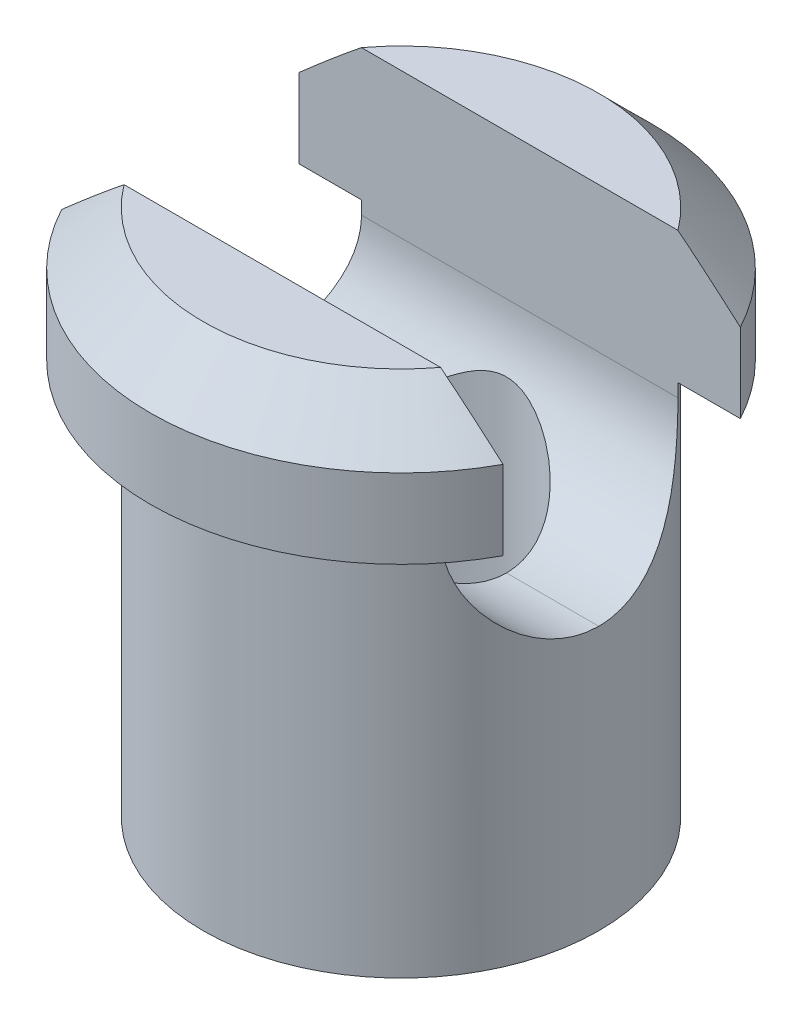
from build123d import *
from build123d.topology import SkipClean

# Parameters (mm, degrees)
SKETCH2_R               = 4
CUT_EXTRUDE1_DEPTH      = 25.093567606
CUT_EXTRUDE2_DEPTH      = 25.093567606
CUT_EXTRUDE2_DEPTH_BACK = 25.093567606
SKETCH3_W               = 9
SKETCH3_H               = 10
FILLET1_START           = 10
FILLET1_OUTLINE_R       = 4
FILLET1_DEPTH           = 4.5000001
FILLET1_START_2         = -7.500000249
FILLET1_2_DEPTH         = 15.000000249


with BuildPart() as part:
    # Sketch1 → Revolve1 (revolve)
    with BuildSketch(Plane.XY, mode=Mode.PRIVATE) as revolve1_sk:
        Polygon((0, 0), (7.5, 0), (7.5, 15), (9.5, 15), (9.5, 18), (7.5, 20), (0, 20), align=None)
    revolve(revolve1_sk.sketch.rotate(Axis((0, 20, 0), (0, -1, 0)), 180), axis=Axis((0, 20, 0), (0, -1, 0)))

    # Sketch2 → Cut-Extrude1 (cut, through all)
    with BuildSketch(Plane.XZ):
        Circle(SKETCH2_R)
    extrude(amount=-CUT_EXTRUDE1_DEPTH, mode=Mode.SUBTRACT)

    # Sketch3 → Cut-Extrude2 (cut, two sides: drawn at the far end of the back side and taken through both)
    with BuildSketch(Plane(origin=(0, 0, 0), x_dir=(0, 0, -1), z_dir=(1, 0, 0)).offset(-CUT_EXTRUDE2_DEPTH_BACK)):
        with Locations((0, 15)):
            Rectangle(SKETCH3_W, SKETCH3_H)
    extrude(amount=CUT_EXTRUDE2_DEPTH + CUT_EXTRUDE2_DEPTH_BACK, mode=Mode.SUBTRACT)

    # Fillet1: read off the stored shape, not the designer's step
    # Fillet1 outline → Fillet1 (add)
    with SkipClean():  # the faces are left unmerged after this step: merging them gives an invalid solid
        with BuildSketch(Plane(origin=(0, 0, 0), x_dir=(1, 0, 0), z_dir=(0, 1, 0)).offset(FILLET1_START)):
            with BuildLine():
                ThreePointArc((6, -4.5), (7.5, 0), (6, 4.5))
                Line((6, 4.5), (-6, 4.5))
                ThreePointArc((-6, 4.5), (-7.5, 0), (-6, -4.5))
                Line((-6, -4.5), (6, -4.5))
            make_face()
            Circle(FILLET1_OUTLINE_R, mode=Mode.SUBTRACT)
        extrude(amount=FILLET1_DEPTH)

    # Fillet1 2 outline → Fillet1 2 (cut)
    with SkipClean():  # the faces are left unmerged after this step: merging them gives an invalid solid
        with BuildSketch(Plane.YZ.offset(FILLET1_START_2)):
            with BuildLine():
                ThreePointArc((10, 0), (11.318019485, -3.181980515), (14.5, -4.5))
                Line((14.5, -4.5), (14.5, 4.5))
                ThreePointArc((14.5, 4.5), (11.318019485, 3.181980515), (10, 0))
            make_face()
        extrude(amount=FILLET1_2_DEPTH, mode=Mode.SUBTRACT)


solid = part.part
